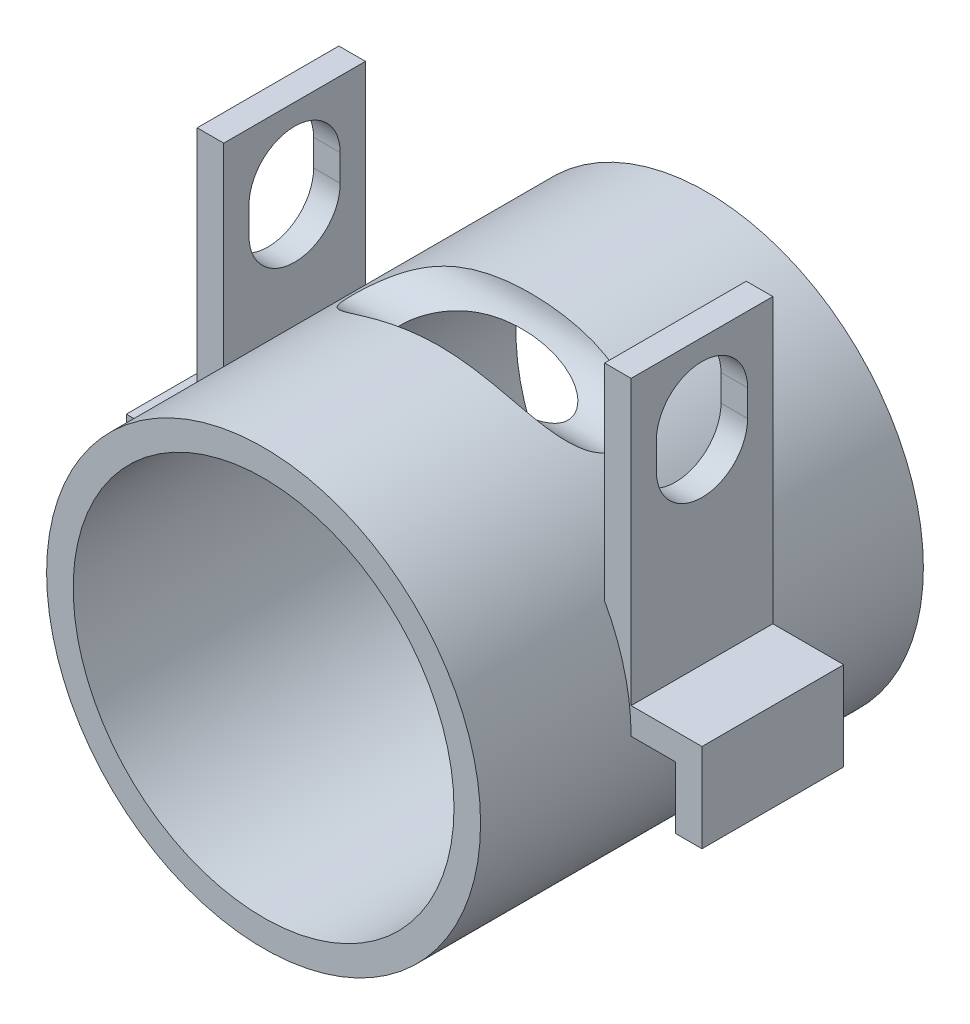
from build123d import *

# Parameters (mm, degrees)
SKETCH1_R           = 24.5
SKETCH1_R_2         = 21.5
BOSS_EXTRUDE1_DEPTH = 50
SKETCH3_R           = 5.15
CUT_EXTRUDE1_DEPTH  = 25
BOSS_EXTRUDE2_DEPTH = 8
BOSS_EXTRUDE3_DEPTH = 8
CUT_EXTRUDE3_DEPTH  = 84.510478444


with BuildPart() as part:
    # Sketch1 → Boss-Extrude1 (new body)
    with BuildSketch(Plane.XY):
        Circle(SKETCH1_R)
        Circle(SKETCH1_R_2, mode=Mode.SUBTRACT)
    extrude(amount=BOSS_EXTRUDE1_DEPTH)

    # Sketch3 → Cut-Extrude1 (cut, symmetric)
    with BuildSketch(Plane(origin=(0, 0, 0), x_dir=(0, 0, -1), z_dir=(1, 0, 0))):
        with Locations((-25, 24.5)):
            Circle(SKETCH3_R)
    extrude(amount=CUT_EXTRUDE1_DEPTH, both=True, mode=Mode.SUBTRACT)

    # Sketch4 → Boss-Extrude2 (add, symmetric)
    with BuildSketch(Plane.XY.offset(25)):
        with BuildLine():
            Line((-21.5, 11.747340124), (-21.5, 35))
            Line((-21.5, 35), (-24.5, 35))
            Line((-24.5, 35), (-24.5, 0))
            ThreePointArc((-24.5, 0), (-23.738154941, 6.062177826), (-21.5, 11.747340124))
        make_face()
    boss_extrude2 = extrude(amount=BOSS_EXTRUDE2_DEPTH, both=True)

    # Sketch6 → Boss-Extrude3 (add, symmetric)
    with BuildSketch(Plane.XY.offset(25)):
        Polygon((-29.5, 0), (-24.5, 0), (-24.5, 3), (-32.5, 3), (-32.5, -7), (-29.5, -7), align=None)
    boss_extrude3 = extrude(amount=BOSS_EXTRUDE3_DEPTH, both=True)

    # Mirror1: Boss-Extrude2, Boss-Extrude3 across plane
    add(boss_extrude2.mirror(Plane(origin=(0, 0, 0), x_dir=(0, 0, 1), z_dir=(1, 0, 0))))
    add(boss_extrude3.mirror(Plane(origin=(0, 0, 0), x_dir=(0, 0, 1), z_dir=(1, 0, 0))))

    # Sketch5 → Cut-Extrude3 (cut, through all)
    with BuildSketch(Plane.ZY.offset(24.5)):
        with BuildLine():
            Line((19.85, 24.5), (19.85, 27.5))
            ThreePointArc((19.85, 27.5), (25, 32.65), (30.15, 27.5))
            Line((30.15, 27.5), (30.15, 24.5))
            ThreePointArc((30.15, 24.5), (25, 19.35), (19.85, 24.5))
        make_face()
    extrude(amount=-CUT_EXTRUDE3_DEPTH, mode=Mode.SUBTRACT)


solid = part.part
